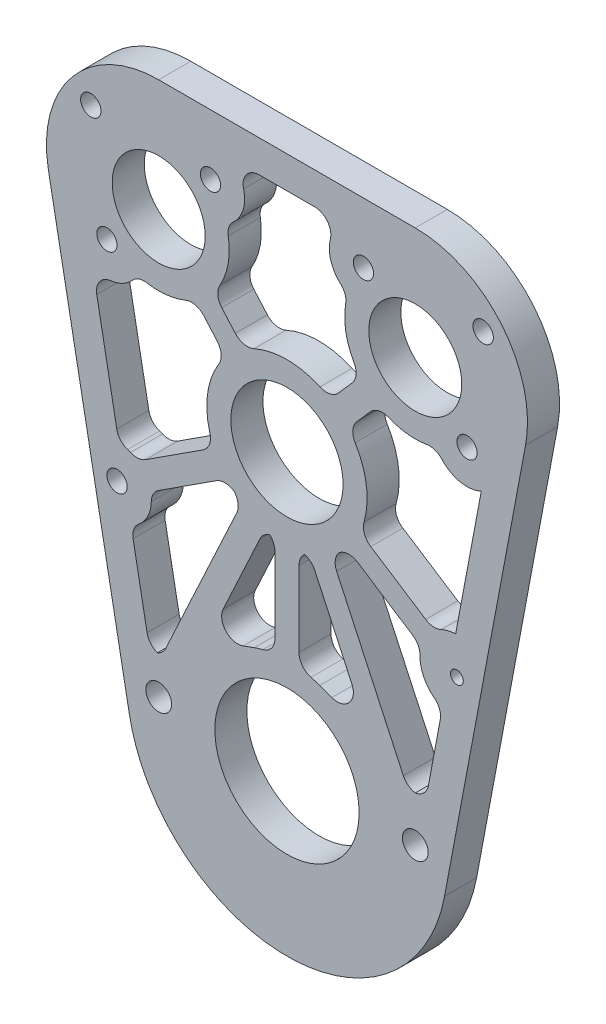
from build123d import *

# Parameters (mm, degrees)
SKETCH1_R                  = 2
SKETCH1_R_2                = 9.2075
SKETCH1_R_3                = 11.1125
SKETCH1_R_4                = 14.2875
SKETCH1_R_5                = 2.5527
SKETCH1_R_6                = 1.27
BOSS_EXTRUDE1_DEPTH        = 6.35
F_10_32_TAPPED_HOLE1_D     = 4.0386
F_10_32_TAPPED_HOLE1_DEPTH = 12.02944
F_10_32_TAPPED_HOLE1_TIP   = 1.213317848
CUT_EXTRUDE2_DEPTH         = 99.892263577
FILLET2_R                  = 3.175


with BuildPart() as part:
    # Sketch1 → Boss-Extrude1 (new body)
    with BuildSketch(Plane.XY):
        with BuildLine():
            Line((-25.4, 51.149123836), (25.4, 51.149123836))
            ThreePointArc((25.4, 51.149123836), (42.504915713, 43.114701113), (47.242846186, 24.820382188))
            Line((47.242846186, 24.820382188), (31.204065979, -60.548688068))
            ThreePointArc((31.204065979, -60.548688068), (5.549270776, -85.947487463), (-27.279865705, -70.930319771))
            Line((-27.279865705, -70.930319771), (-27.999667191, -69.655539905))
            ThreePointArc((-27.999667191, -69.655539905), (-29.950028263, -65.224620521), (-31.204065979, -60.548688068))
            Line((-31.204065979, -60.548688068), (-47.242846186, 24.820382188))
            ThreePointArc((-47.242846186, 24.820382188), (-42.504915713, 43.114701113), (-25.4, 51.149123836))
        make_face()
        with Locations((-15.14454751, 39.179576326)):
            Circle(SKETCH1_R, mode=Mode.SUBTRACT)
        with Locations((-35.65545249, 18.668671346)):
            Circle(SKETCH1_R, mode=Mode.SUBTRACT)
        with Locations((15.14454751, 39.179576326)):
            Circle(SKETCH1_R, mode=Mode.SUBTRACT)
        with Locations((35.65545249, 18.668671346)):
            Circle(SKETCH1_R, mode=Mode.SUBTRACT)
        with Locations((25.4, 28.924123836)):
            Circle(SKETCH1_R_2, mode=Mode.SUBTRACT)
        with Locations((-25.4, 28.924123836)):
            Circle(SKETCH1_R_2, mode=Mode.SUBTRACT)
        Circle(SKETCH1_R_3, mode=Mode.SUBTRACT)
        with Locations((0, -54.6862)):
            Circle(SKETCH1_R_4, mode=Mode.SUBTRACT)
        with Locations((25.4, -54.6862)):
            Circle(SKETCH1_R_5, mode=Mode.SUBTRACT)
        with Locations((-25.4, -54.6862)):
            Circle(SKETCH1_R_5, mode=Mode.SUBTRACT)
        with Locations((38.839576632, 40.073863125)):
            Circle(SKETCH1_R_6, mode=Mode.SUBTRACT)
        with Locations((-38.839576632, 40.073863125)):
            Circle(SKETCH1_R_6, mode=Mode.SUBTRACT)
        with Locations((-33.642289639, -21.778141451)):
            Circle(SKETCH1_R_6, mode=Mode.SUBTRACT)
        with Locations((33.642289639, -21.778141451)):
            Circle(SKETCH1_R_6, mode=Mode.SUBTRACT)
    extrude(amount=BOSS_EXTRUDE1_DEPTH)

    # #10-32 Tapped Hole1
    with Locations(Plane(origin=(-38.839576632, 40.073863125, 6.35), x_dir=(1, 0, 0), z_dir=(0, 0, 1))):
        with Locations((0, 0), (77.679153264, 0), (5.197286993, -61.852004576)):
            Hole(F_10_32_TAPPED_HOLE1_D / 2, depth=F_10_32_TAPPED_HOLE1_DEPTH)
            with Locations((0, 0, -(F_10_32_TAPPED_HOLE1_DEPTH + F_10_32_TAPPED_HOLE1_TIP / 2))):  # 118° drill point
                Cone(0, F_10_32_TAPPED_HOLE1_D / 2, F_10_32_TAPPED_HOLE1_TIP, mode=Mode.SUBTRACT)

    # Sketch5 → Cut-Extrude2 (cut, through all)
    with BuildSketch(Plane.XY.offset(6.35)):
        with BuildLine():
            Line((-24.813855531, -47.39452079), (-8.904792953, -13.142309061))
            ThreePointArc((-8.904792953, -13.142309061), (-10.475087885, -11.928460035), (-11.881646743, -10.528157278))
            Line((-11.881646743, -10.528157278), (-27.017696568, -20.326391513))
            ThreePointArc((-27.017696568, -20.326391513), (-27.585254368, -24.828573381), (-30.864649823, -27.965025019))
            Line((-30.864649823, -27.965025019), (-27.177545182, -47.590251567))
            ThreePointArc((-27.177545182, -47.590251567), (-26.003685803, -47.395952097), (-24.813855531, -47.39452079))
        make_face()
        with BuildLine():
            ThreePointArc((-14.469685141, -6.530224875), (-15.724434186, 2.181236924), (-12.145844148, 10.222235319))
            Line((-12.145844148, 10.222235319), (-18.106090407, 17.009436142))
            ThreePointArc((-18.106090407, 17.009436142), (-23.713214285, 15.056331872), (-29.62504423, 15.608347432))
            ThreePointArc((-29.62504423, 15.608347432), (-33.426448335, 12.284084693), (-38.470821379, 12.520085796))
            Line((-38.470821379, 12.520085796), (-33.299522858, -15.005009075))
            ThreePointArc((-33.299522858, -15.005009075), (-31.354825082, -15.393760734), (-29.605734966, -16.32845911))
            Line((-29.605734966, -16.32845911), (-14.469685141, -6.530224875))
        make_face()
        with BuildLine():
            ThreePointArc((-2.38125, -15.695390197), (-3.345762389, -15.518424502), (-4.297508552, -15.28224608))
            Line((-4.297508552, -15.28224608), (-15.854365092, -40.164158211))
            Line((-15.854365092, -40.164158211), (-6.48170484, -36.77279713))
            ThreePointArc((-6.48170484, -36.77279713), (-4.458881555, -36.165377252), (-2.38125, -35.785614072))
            Line((-2.38125, -35.785614072), (-2.38125, -15.695390197))
        make_face()
        with BuildLine():
            Line((-14.527553146, 20.151963361), (-8.567306887, 13.364762538))
            ThreePointArc((-8.567306887, 13.364762538), (0, 15.875), (8.567306887, 13.364762538))
            Line((8.567306887, 13.364762538), (14.527553146, 20.151963361))
            ThreePointArc((14.527553146, 20.151963361), (11.670492775, 26.343129578), (12.084223595, 33.149168066))
            ThreePointArc((12.084223595, 33.149168066), (8.394277662, 38.773050516), (11.382620871, 44.799123836))
            Line((11.382620871, 44.799123836), (-11.382620871, 44.799123836))
            ThreePointArc((-11.382620871, 44.799123836), (-8.394277662, 38.773050516), (-12.084223595, 33.149168066))
            ThreePointArc((-12.084223595, 33.149168066), (-11.670492775, 26.343129578), (-14.527553146, 20.151963361))
        make_face()
        with BuildLine():
            ThreePointArc((4.45197845, -15.237962885), (3.424260898, -15.501292278), (2.38125, -15.695390197))
            Line((2.38125, -15.695390197), (2.38125, -35.785614072))
            ThreePointArc((2.38125, -35.785614072), (4.458881555, -36.165377252), (6.48170484, -36.77279713))
            Line((6.48170484, -36.77279713), (16.064762788, -40.240287564))
            Line((16.064762788, -40.240287564), (4.45197845, -15.237962885))
        make_face()
        with BuildLine():
            Line((18.106090407, 17.009436142), (12.145844148, 10.222235319))
            ThreePointArc((12.145844148, 10.222235319), (15.724434186, 2.181236924), (14.469685141, -6.530224875))
            Line((14.469685141, -6.530224875), (29.129945464, -16.020459531))
            ThreePointArc((29.129945464, -16.020459531), (31.14158255, -14.903651281), (33.400613995, -14.466934715))
            Line((33.400613995, -14.466934715), (38.470821379, 12.520085796))
            ThreePointArc((38.470821379, 12.520085796), (33.426448335, 12.284084693), (29.62504423, 15.608347432))
            ThreePointArc((29.62504423, 15.608347432), (23.713214285, 15.056331872), (18.106090407, 17.009436142))
        make_face()
        with BuildLine():
            ThreePointArc((11.881646743, -10.528157278), (10.414581776, -11.981323442), (8.771307576, -13.23177193))
            Line((8.771307576, -13.23177193), (23.946065705, -45.90302618))
            ThreePointArc((23.946065705, -45.90302618), (25.714821926, -45.78906819), (27.471099817, -46.02775829))
            Line((27.471099817, -46.02775829), (30.763558685, -28.503099379))
            ThreePointArc((30.763558685, -28.503099379), (27.09299641, -25.036808239), (26.541907066, -20.018391934))
            Line((26.541907066, -20.018391934), (11.881646743, -10.528157278))
        make_face()
    extrude(amount=-CUT_EXTRUDE2_DEPTH, mode=Mode.SUBTRACT)

    # Fillet2
    # the kernel refuses this fillet: 3.175 mm, written as the material it adds along each edge
    with BuildSketch(Plane(origin=(23.946065705, -45.90302618, 6.35), x_dir=(0.9981756767261354, 0.06037647217519295, 0), z_dir=(0, 0, -1))) as fillet2_piece_1:
        with BuildLine():
            CenterArc((2.170423522, -3.157965013), FILLET2_R, 95.937874905, 62.610178346)
            Line((-0.784627149, -1.996801573), (0, 0))
            ThreePointArc((0, 0), (0.920984799, -0.047766105), (1.841969599, 0))
        make_face()
    extrude(amount=6.35)
    with BuildSketch(Plane(origin=(8.771307576, -13.23177193, 6.35), x_dir=(0.4212474446415146, -0.9069457483129816, 0), z_dir=(0, 0, -1)), Plane(origin=(-11.881646743, -10.528157278, 6.35), x_dir=(-0.8394608720498955, -0.5434201360800212, 0), z_dir=(0, 0, -1)), Plane(origin=(-12.145844148, 10.222235319, 6.35), x_dir=(-0.6598482349060056, 0.7513988999801827, 0), z_dir=(0, 0, -1)), Plane(origin=(14.469685141, -6.530224875, 6.35), x_dir=(0.8394608720498943, -0.5434201360800233, 0), z_dir=(0, 0, -1)), Plane(origin=(8.567306887, 13.364762538, 6.35), x_dir=(0.6598482349059847, 0.7513988999802013, 0), z_dir=(0, 0, -1))) as fillet2_piece_2:
        with BuildLine():
            CenterArc((2.526316253, -3.175), FILLET2_R, 90, 73.0422367)
            ThreePointArc((-0.510634822, -2.248958333), (-0.214424432, -1.133764078), (0, 0))
            Line((0, 0), (2.526316253, 0))
        make_face()
    extrude(amount=6.35)
    with BuildSketch(Plane(origin=(11.881646743, -10.528157278, 6.35), x_dir=(0.8394608720498972, -0.5434201360800189, 0), z_dir=(0, 0, -1)), Plane(origin=(-2.38125, -15.695390197, 6.35), x_dir=(0, -1, 0), z_dir=(0, 0, -1)), Plane(origin=(12.145844148, 10.222235319, 6.35), x_dir=(0.6598482349059996, 0.7513988999801882, 0), z_dir=(0, 0, -1))) as fillet2_piece_3:
        with BuildLine():
            CenterArc((2.526316253, 3.175), FILLET2_R, 196.9577633, 73.0422367)
            ThreePointArc((-0.510634822, 2.248958333), (-0.214424432, 1.133764078), (0, 0))
            Line((0, 0), (2.526316253, 0))
        make_face()
    extrude(amount=6.35)
    with BuildSketch(Plane(origin=(26.541907066, -20.018391934, 6.35), x_dir=(-0.8394608720498852, 0.5434201360800374, 0), z_dir=(0, 0, -1))) as fillet2_piece_4:
        with BuildLine():
            CenterArc((1.981109709, -3.175), FILLET2_R, 90, 58.01744603)
            ThreePointArc((-0.711955175, -1.493326271), (-0.313626631, -0.766854291), (0, 0))
            Line((0, 0), (1.981109709, 0))
        make_face()
    extrude(amount=6.35)
    with BuildSketch(Plane(origin=(-27.177545182, -47.590251567, 6.35), x_dir=(-0.18464529349029274, 0.9828052276986949, 0), z_dir=(0, 0, -1))) as fillet2_piece_5:
        with BuildLine():
            CenterArc((2.824362541, 3.175), FILLET2_R, 195.131164146, 74.868835854)
            ThreePointArc((-0.240562734, 2.346230998), (-0.025101359, 1.182874454), (0, 0))
            Line((0, 0), (2.824362541, 0))
        make_face()
    extrude(amount=6.35)
    with BuildSketch(Plane(origin=(-30.864649823, -27.965025019, 6.35), x_dir=(0.1846452934902994, -0.9828052276986938, 0), z_dir=(0, 0, -1))) as fillet2_piece_6:
        with BuildLine():
            CenterArc((2.150558838, -3.175), FILLET2_R, 90, 61.424503729)
            ThreePointArc((-0.637686848, -1.656345663), (-0.264424358, -0.849123967), (0, 0))
            Line((0, 0), (2.150558838, 0))
        make_face()
    extrude(amount=6.35)
    with BuildSketch(Plane(origin=(-33.299522858, -15.005009075, 6.35), x_dir=(0.9835208172445462, -0.1807949170928764, 0), z_dir=(0, 0, -1))) as fillet2_piece_7:
        with BuildLine():
            CenterArc((2.190322598, -3.147699991), FILLET2_R, 97.518978435, 61.424503729)
            Line((-0.772671445, -2.006958433), (0, 0))
            ThreePointArc((0, 0), (0.887429641, -0.058312819), (1.774859282, 0))
        make_face()
    extrude(amount=6.35)
    with BuildSketch(Plane(origin=(-27.017696568, -20.326391513, 6.35), x_dir=(0.0989499734468529, -0.9950924091534752, 0), z_dir=(0, 0, -1))) as fillet2_piece_8:
        with BuildLine():
            CenterArc((1.947683222, -3.153433004), FILLET2_R, 96.682004109, 56.079937144)
            Line((-0.875249123, -1.700271631), (0, 0))
            ThreePointArc((0, 0), (0.789122034, -0.046067103), (1.578244068, 0))
        make_face()
    extrude(amount=6.35)
    with BuildSketch(Plane(origin=(-2.38125, -35.785614072, 6.35), x_dir=(0, 1, 0), z_dir=(0, 0, -1))) as fillet2_piece_9:
        with BuildLine():
            CenterArc((2.618677789, -3.175), FILLET2_R, 90, 75.522487814)
            ThreePointArc((-0.455502742, -2.38125), (-0.189831312, -1.197878623), (0, 0))
            Line((0, 0), (2.618677789, 0))
        make_face()
    extrude(amount=6.35)
    with BuildSketch(Plane(origin=(-38.470821379, 12.520085796, 6.35), x_dir=(0.18464529349028944, -0.9828052276986956, 0), z_dir=(0, 0, -1))) as fillet2_piece_10:
        with BuildLine():
            CenterArc((4.387834699, -3.175), FILLET2_R, 90, 94.196890108)
            ThreePointArc((1.221348618, -3.407359406), (0.842883833, -1.620445519), (0, 0))
            Line((0, 0), (4.387834699, 0))
        make_face()
    extrude(amount=6.35)
    with BuildSketch(Plane(origin=(-18.106090407, 17.009436142, 6.35), x_dir=(-0.8915887195092606, -0.45284606130984195, 0), z_dir=(0, 0, -1)), Plane(origin=(14.527553146, 20.151963361, 6.35), x_dir=(-0.5642443308564503, 0.8256078579424718, 0), z_dir=(0, 0, -1))) as fillet2_piece_11:
        with BuildLine():
            CenterArc((2.467034449, -3.165004403), FILLET2_R, 94.547619578, 71.09051251)
            Line((-0.608741903, -2.37746086), (0, 0))
            ThreePointArc((0, 0), (1.10764812, -0.043980625), (2.21529624, 0))
        make_face()
    extrude(amount=6.35)
    with BuildSketch(Plane(origin=(-14.469685141, -6.530224875, 6.35), x_dir=(-0.3440599520925635, 0.9389476819110121, 0), z_dir=(0, 0, -1)), Plane(origin=(4.45197845, -15.237962885, 6.35), x_dir=(-0.9777062537991693, -0.20997733516261785, 0), z_dir=(0, 0, -1)), Plane(origin=(-8.567306887, 13.364762538, 6.35), x_dir=(0.8788508020140211, 0.4770967069675831, 0), z_dir=(0, 0, -1))) as fillet2_piece_12:
        with BuildLine():
            CenterArc((2.536820731, -3.166613236), FILLET2_R, 94.165418371, 73.0422367)
            Line((-0.559372422, -2.46361042), (0, 0))
            ThreePointArc((0, 0), (1.153100332, -0.041933821), (2.306200665, 0))
        make_face()
    extrude(amount=6.35)
    with BuildSketch(Plane(origin=(-29.605734966, -16.32845911, 6.35), x_dir=(0.8394608720499046, 0.5434201360800074, 0), z_dir=(0, 0, -1))) as fillet2_piece_13:
        with BuildLine():
            CenterArc((1.912324409, -3.175), FILLET2_R, 90, 56.079937144)
            ThreePointArc((-0.722344352, -1.403236607), (-0.320213336, -0.722702693), (0, 0))
            Line((0, 0), (1.912324409, 0))
        make_face()
    extrude(amount=6.35)
    with BuildSketch(Plane(origin=(18.106090407, 17.009436142, 6.35), x_dir=(-0.6598482349059278, -0.751398899980251, 0), z_dir=(0, 0, -1)), Plane(origin=(-14.527553146, 20.151963361, 6.35), x_dir=(0.6598482349059827, -0.751398899980203, 0), z_dir=(0, 0, -1))) as fillet2_piece_14:
        with BuildLine():
            CenterArc((2.454157054, -3.175), FILLET2_R, 90, 71.09051251)
            ThreePointArc((-0.549493622, -2.146064815), (-0.232140649, -1.083941591), (0, 0))
            Line((0, 0), (2.454157054, 0))
        make_face()
    extrude(amount=6.35)
    with BuildSketch(Plane(origin=(29.62504423, 15.608347432, 6.35), x_dir=(-0.9718852801044001, -0.23545488382361449, 0), z_dir=(0, 0, -1))) as fillet2_piece_15:
        with BuildLine():
            CenterArc((2.162667805, -3.16732145), FILLET2_R, 93.985592978, 57.645860045)
            ThreePointArc((-0.63104498, -1.658747992), (-0.260871655, -0.85016506), (0, 0))
            ThreePointArc((0, 0), (0.970993708, -0.033785621), (1.941987416, 0))
        make_face()
    extrude(amount=6.35)
    with BuildSketch(Plane(origin=(29.129945464, -16.020459531, 6.35), x_dir=(0.8517873831390265, 0.5238876348275167, 0), z_dir=(0, 0, -1))) as fillet2_piece_16:
        with BuildLine():
            CenterArc((2.013377815, -3.154636342), FILLET2_R, 96.492710737, 58.01744603)
            Line((-0.852572722, -1.788271633), (0, 0))
            ThreePointArc((0, 0), (0.827179473, -0.046917867), (1.654358946, 0))
        make_face()
    extrude(amount=6.35)
    with BuildSketch(Plane(origin=(2.38125, -35.785614072, 6.35), x_dir=(0.9821918433556398, -0.18788076763109685, 0), z_dir=(0, 0, -1))) as fillet2_piece_17:
        with BuildLine():
            CenterArc((2.626459909, -3.168565402), FILLET2_R, 93.648378202, 75.522487814)
            Line((-0.491999193, -2.572043965), (0, 0))
            ThreePointArc((0, 0), (1.212212266, -0.038607589), (2.424424532, 0))
        make_face()
    extrude(amount=6.35)
    with BuildSketch(Plane(origin=(2.38125, -15.695390197, 6.35), x_dir=(0.9751789458520725, 0.22141820965503414, 0), z_dir=(0, 0, -1))) as fillet2_piece_18:
        with BuildLine():
            CenterArc((2.536820731, 3.166613236), FILLET2_R, 192.792344929, 73.0422367)
            Line((-0.559372422, 2.46361042), (0, 0))
            ThreePointArc((0, 0), (1.153100332, 0.041933821), (2.306200665, 0))
        make_face()
    extrude(amount=6.35)
    with BuildSketch(Plane(origin=(-29.62504423, 15.608347432, 6.35), x_dir=(0.9718852801043993, -0.23545488382361762, 0), z_dir=(0, 0, -1))) as fillet2_piece_19:
        with BuildLine():
            CenterArc((2.162667805, 3.16732145), FILLET2_R, 208.368546977, 57.645860045)
            ThreePointArc((-0.63104498, 1.658747992), (-0.260871655, 0.85016506), (0, 0))
            ThreePointArc((0, 0), (0.970993708, 0.033785621), (1.941987416, 0))
        make_face()
    extrude(amount=6.35)
    with BuildSketch(Plane(origin=(-12.084223595, 33.149168066, 6.35), x_dir=(0.8246499702941673, 0.5656433739502559, 0), z_dir=(0, 0, -1))) as fillet2_piece_20:
        with BuildLine():
            CenterArc((2.191347329, 3.147547312), FILLET2_R, 204.81413513, 57.645860045)
            ThreePointArc((-0.690517526, 1.815075941), (-0.313681078, 0.919551212), (0, 0))
            ThreePointArc((0, 0), (0.88736445, 0.058472063), (1.7747289, 0))
        make_face()
    extrude(amount=6.35)
    with BuildSketch(Plane(origin=(11.382620871, 44.799123836, 6.35), x_dir=(-1, 0, 0), z_dir=(0, 0, -1))) as fillet2_piece_21:
        with BuildLine():
            CenterArc((5.870211946, -3.175), FILLET2_R, 90, 104.24047737)
            ThreePointArc((2.792773958, -3.956025242), (1.762630657, -1.719461236), (0, 0))
            Line((0, 0), (5.870211946, 0))
        make_face()
    extrude(amount=6.35)
    with BuildSketch(Plane(origin=(12.084223595, 33.149168066, 6.35), x_dir=(-0.8246499702942053, 0.5656433739502005, 0), z_dir=(0, 0, -1))) as fillet2_piece_22:
        with BuildLine():
            CenterArc((2.191347329, -3.147547312), FILLET2_R, 97.540004825, 57.645860045)
            ThreePointArc((-0.690517526, -1.815075941), (-0.313681078, -0.919551212), (0, 0))
            ThreePointArc((0, 0), (0.88736445, -0.058472063), (1.7747289, 0))
        make_face()
    extrude(amount=6.35)
    with BuildSketch(Plane(origin=(-11.382620871, 44.799123836, 6.35), x_dir=(0.5767225543073922, -0.8169400806382051, 0), z_dir=(0, 0, -1))) as fillet2_piece_23:
        with BuildLine():
            CenterArc((5.979268384, -2.964517311), FILLET2_R, 110.979875819, 104.24047737)
            Line((3.385483628, -4.795611421), (0, 0))
            ThreePointArc((0, 0), (2.421245656, -0.448311554), (4.842491311, 0))
        make_face()
    extrude(amount=6.35)
    with BuildSketch(Plane(origin=(30.763558685, -28.503099379, 6.35), x_dir=(-0.8624478196439587, 0.5061459852566073, 0), z_dir=(0, 0, -1))) as fillet2_piece_24:
        with BuildLine():
            CenterArc((2.241873995, -3.149732386), FILLET2_R, 97.233297448, 62.999700492)
            Line((-0.746041351, -2.075960119), (0, 0))
            ThreePointArc((0, 0), (0.921055222, -0.058216583), (1.842110444, 0))
        make_face()
    extrude(amount=6.35)
    with BuildSketch(Plane(origin=(27.471099817, -46.02775829, 6.35), x_dir=(0.18464529349029338, 0.9828052276986948, 0), z_dir=(0, 0, -1))) as fillet2_piece_25:
        with BuildLine():
            CenterArc((2.871216617, -3.175), FILLET2_R, 90, 76.895975379)
            ThreePointArc((-0.221106524, -2.455164883), (-0.02516467, -1.235272343), (0, 0))
            Line((0, 0), (2.871216617, 0))
        make_face()
    extrude(amount=6.35)
    with BuildSketch(Plane(origin=(-8.904792953, -13.142309061, 6.35), x_dir=(-0.785364270252568, 0.6190338948802813, 0), z_dir=(0, 0, -1))) as fillet2_piece_26:
        with BuildLine():
            CenterArc((2.512462802, -3.166773726), FILLET2_R, 94.125353451, 72.542396876)
            Line((-0.57696851, -2.434626768), (0, 0))
            ThreePointArc((0, 0), (1.142028546, -0.04113137), (2.284057092, 0))
        make_face()
    extrude(amount=6.35)
    with BuildSketch(Plane(origin=(-24.813855531, -47.39452079, 6.35), x_dir=(0.42124744464143826, 0.906945748313017, 0), z_dir=(0, 0, -1))) as fillet2_piece_27:
        with BuildLine():
            CenterArc((1.936695488, -3.175), FILLET2_R, 90, 56.989399658)
            ThreePointArc((-0.725763594, -1.44527845), (-0.322818127, -0.742757669), (0, 0))
            Line((0, 0), (1.936695488, 0))
        make_face()
    extrude(amount=6.35)
    with BuildSketch(Plane(origin=(-4.297508552, -15.28224608, 6.35), x_dir=(-0.42124744464138836, -0.9069457483130401, 0), z_dir=(0, 0, -1))) as fillet2_piece_28:
        with BuildLine():
            CenterArc((2.502059184, -3.175), FILLET2_R, 90, 72.542396876)
            ThreePointArc((-0.52669778, -2.2225), (-0.223326042, -1.12073479), (0, 0))
            Line((0, 0), (2.502059184, 0))
        make_face()
    extrude(amount=6.35)
    with BuildSketch(Plane(origin=(16.064762788, -40.240287564, 6.35), x_dir=(-0.4212474446414388, 0.9069457483130168, 0), z_dir=(0, 0, -1)), Plane(origin=(-15.854365092, -40.164158211, 6.35), x_dir=(0.9403361086432114, 0.3402469732146674, 0), z_dir=(0, 0, -1))) as fillet2_piece_29:
        with BuildLine():
            CenterArc((FILLET2_R * 2.40265836652, -FILLET2_R), FILLET2_R, 90, 134.805290683)
            Line((FILLET2_R * 1.69315269881, -FILLET2_R * 1.7046997286), (0, 0))
            Line((0, 0), (FILLET2_R * 2.40265836652, 0))
        make_face()
    extrude(amount=6.35)


solid = part.part
